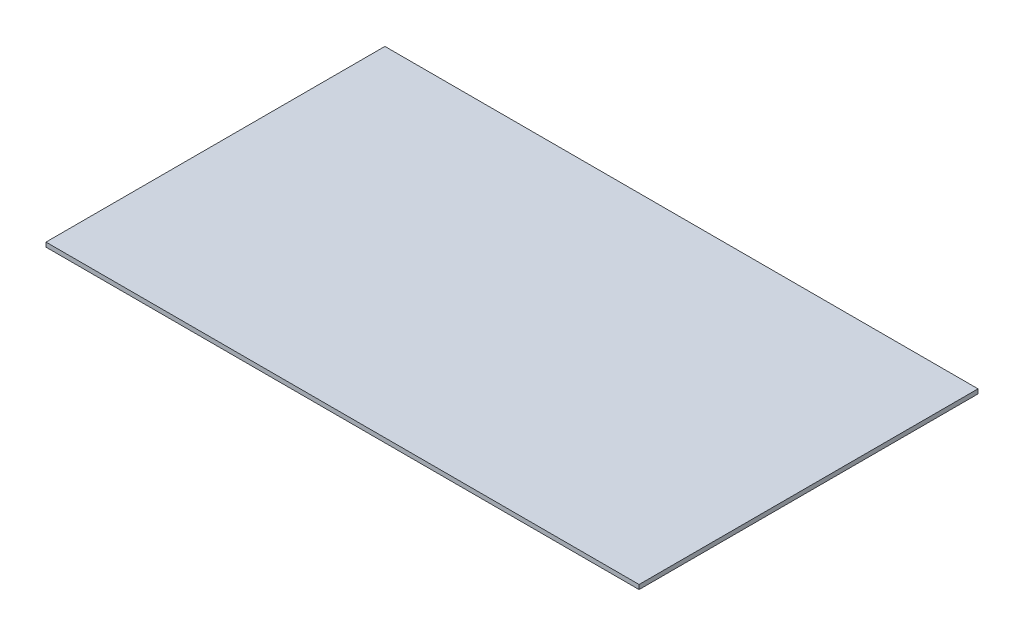
from build123d import *

# Parameters (mm, degrees)
SKETCH1_W          = 355.6
SKETCH1_H          = 203.2
BASE_FLANGE1_DEPTH = 2.65684


# Sheet-metal steps are written as plain solids
with BuildPart() as part:
    # Sketch1 → Base-Flange1 (new body)
    with BuildSketch(Plane(origin=(0, 0, 0), x_dir=(1, 0, 0), z_dir=(0, 1, 0))):
        with Locations((177.8, 101.6)):
            Rectangle(SKETCH1_W, SKETCH1_H)
    extrude(amount=-BASE_FLANGE1_DEPTH)


solid = part.part
